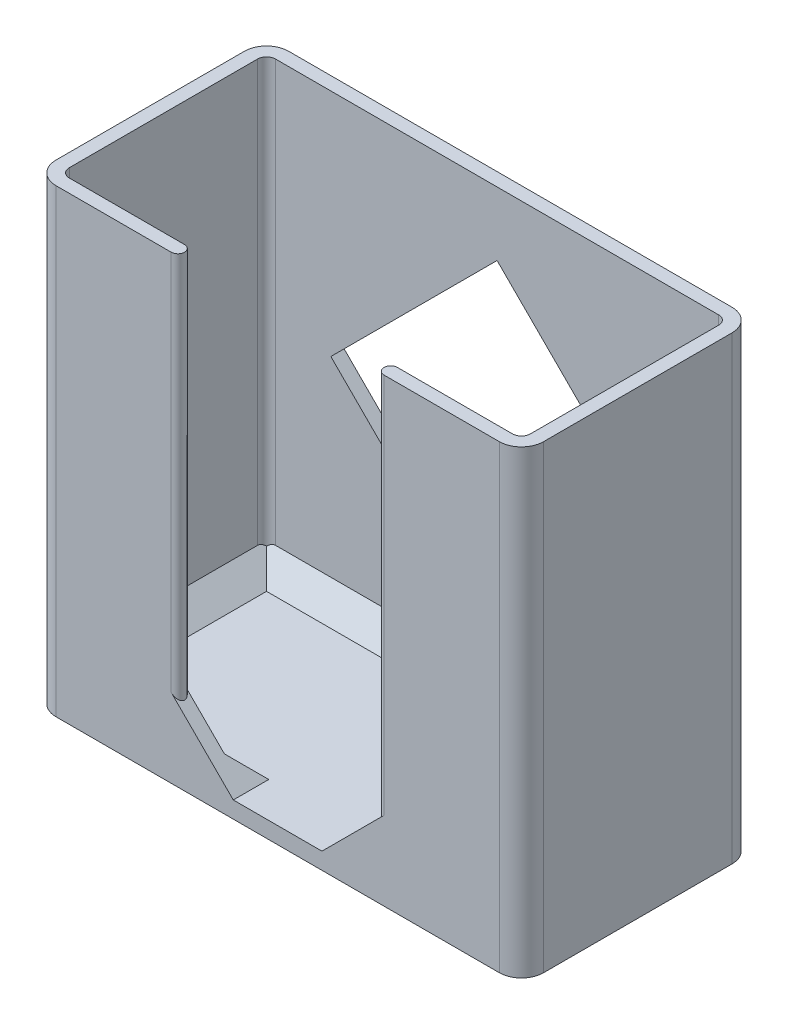
from build123d import *

# Parameters (mm, degrees)
RESSALTO_EXTRUS_O1_DEPTH = 1.5
RESSALTO_EXTRUS_O2_DEPTH = 40
ESBO_O4_W                = 18
ESBO_O4_H                = 3
CORTE_EXTRUS_O1_DEPTH    = 40
CORTE_EXTRUS_O2_DEPTH    = 8
CHANFRO1_SIZE            = 5
CHANFRO2_SIZE            = 2
FILETE2_START            = 6.5
FILETE2_DEPTH            = 35.5
FILETE2_START_2          = -3
FILETE2_2_DEPTH          = 1.232233047
FILETE3_START            = 6.5
FILETE3_DEPTH            = 35.5
FILETE3_START_2          = 1.767766953
FILETE3_2_DEPTH          = 1.232233047


with BuildPart() as part:
    # Esboço1 → Ressalto-extrusão1 (new body)
    with BuildSketch(Plane(origin=(0, 0, 0), x_dir=(1, 0, 0), z_dir=(0, 1, 0))):
        with BuildLine():
            Line((-20, -10.5), (20, -10.5))
            ThreePointArc((20, -10.5), (21.414213562, -9.914213562), (22, -8.5))
            Line((22, -8.5), (22, 8.5))
            ThreePointArc((22, 8.5), (21.414213562, 9.914213562), (20, 10.5))
            Line((20, 10.5), (-20, 10.5))
            ThreePointArc((-20, 10.5), (-21.414213562, 9.914213562), (-22, 8.5))
            Line((-22, 8.5), (-22, -8.5))
            ThreePointArc((-22, -8.5), (-21.414213562, -9.914213562), (-20, -10.5))
        make_face()
    extrude(amount=RESSALTO_EXTRUS_O1_DEPTH)

    # Esboço3 → Ressalto-extrusão2 (add)
    with BuildSketch(Plane(origin=(0, 1.5, 0), x_dir=(1, 0, 0), z_dir=(0, 1, 0))):
        with BuildLine():
            Line((-20, -10.5), (20, -10.5))
            ThreePointArc((20, -10.5), (21.414213562, -9.914213562), (22, -8.5))
            Line((22, -8.5), (22, 8.5))
            ThreePointArc((22, 8.5), (21.414213562, 9.914213562), (20, 10.5))
            Line((20, 10.5), (-20, 10.5))
            ThreePointArc((-20, 10.5), (-21.414213562, 9.914213562), (-22, 8.5))
            Line((-22, 8.5), (-22, -8.5))
            ThreePointArc((-22, -8.5), (-21.414213562, -9.914213562), (-20, -10.5))
        make_face()
        with BuildLine():
            Line((-20, 9.3), (20, 9.3))
            ThreePointArc((20, 9.3), (20.565685425, 9.065685425), (20.8, 8.5))
            Line((20.8, 8.5), (20.8, -8.5))
            ThreePointArc((20.8, -8.5), (20.565685425, -9.065685425), (20, -9.3))
            Line((20, -9.3), (-20, -9.3))
            ThreePointArc((-20, -9.3), (-20.565685425, -9.065685425), (-20.8, -8.5))
            Line((-20.8, -8.5), (-20.8, 8.5))
            ThreePointArc((-20.8, 8.5), (-20.565685425, 9.065685425), (-20, 9.3))
        make_face(mode=Mode.SUBTRACT)
    extrude(amount=RESSALTO_EXTRUS_O2_DEPTH)

    # Esboço4 → Corte-extrusão1 (cut)
    with BuildSketch(Plane(origin=(0, 41.5, 0), x_dir=(1, 0, 0), z_dir=(0, 1, 0))):
        with Locations((0, -9.3)):
            Rectangle(ESBO_O4_W, ESBO_O4_H)
    extrude(amount=-CORTE_EXTRUS_O1_DEPTH, mode=Mode.SUBTRACT)

    # Esboço5 → Corte-extrusão2 (cut)
    with BuildSketch(Plane(origin=(0, 0, -10.5), x_dir=(-1, 0, 0), z_dir=(0, 0, -1))):
        Polygon((0, 5.75), (15, 20.75), (0, 35.75), (-15, 20.75), align=None)
    extrude(amount=-CORTE_EXTRUS_O2_DEPTH, mode=Mode.SUBTRACT)

    # Chanfro1
    chanfro1_edges = [part.edges().sort_by_distance(p)[0] for p in [
        (9, 1.5, 9.9),
        (-9, 1.5, 9.9),
    ]]
    chamfer(chanfro1_edges, length=CHANFRO1_SIZE)

    # Chanfro2
    # the kernel refuses this chamfer: 2 mm, written as the material it adds along each edge
    with BuildSketch(Plane(origin=(-1.143365976, 1.5, 9.3), x_dir=(0, 1, 0), z_dir=(1, 0, 0))) as chanfro2_piece_1_section:
        Polygon((CHANFRO2_SIZE, 0), (0, -CHANFRO2_SIZE), (0, 0), align=None)
    chanfro2_piece_1 = extrude(amount=26.286731952, mode=Mode.PRIVATE)
    chanfro2_piece_1 = split(chanfro2_piece_1, bisect_by=Plane(origin=(20.8, 1.5, 9.3), z_dir=(-1, 0, 0)), keep=Keep.TOP, mode=Mode.PRIVATE)
    chanfro2_piece_1 = split(chanfro2_piece_1, bisect_by=Plane(origin=(1.428317012, -1.071682988, 9.3), z_dir=(0.7071067811865476, -0.7071067811865476, 0)), keep=Keep.TOP, mode=Mode.PRIVATE)
    add(chanfro2_piece_1)
    with BuildSketch(Plane(origin=(20.8, 1.5, -13.643365976), x_dir=(0, 1, 0), z_dir=(0, 0, 1))) as chanfro2_piece_2_section:
        Polygon((CHANFRO2_SIZE, 0), (0, CHANFRO2_SIZE), (0, 0), align=None)
    chanfro2_piece_2 = extrude(amount=27.286731952, mode=Mode.PRIVATE)
    chanfro2_piece_2 = split(chanfro2_piece_2, bisect_by=Plane(origin=(20.8, 1.5, -9.3), z_dir=(0, 0, 1)), keep=Keep.TOP, mode=Mode.PRIVATE)
    chanfro2_piece_2 = split(chanfro2_piece_2, bisect_by=Plane(origin=(20.8, 1.5, 9.3), z_dir=(0, 0, -1)), keep=Keep.TOP, mode=Mode.PRIVATE)
    add(chanfro2_piece_2)
    with BuildSketch(Plane(origin=(-25.143365976, 1.5, 9.3), x_dir=(0, 1, 0), z_dir=(1, 0, 0))) as chanfro2_piece_3_section:
        Polygon((CHANFRO2_SIZE, 0), (0, -CHANFRO2_SIZE), (0, 0), align=None)
    chanfro2_piece_3 = extrude(amount=26.286731952, mode=Mode.PRIVATE)
    chanfro2_piece_3 = split(chanfro2_piece_3, bisect_by=Plane(origin=(-20.8, 1.5, 9.3), z_dir=(1, 0, 0)), keep=Keep.TOP, mode=Mode.PRIVATE)
    chanfro2_piece_3 = split(chanfro2_piece_3, bisect_by=Plane(origin=(-14.571682988, 12.071682988, 9.3), z_dir=(-0.7071067811865476, -0.7071067811865476, 0)), keep=Keep.TOP, mode=Mode.PRIVATE)
    add(chanfro2_piece_3)
    with BuildSketch(Plane(origin=(-20.8, 1.5, 13.643365976), x_dir=(0, 1, 0), z_dir=(0, 0, -1))) as chanfro2_piece_4_section:
        Polygon((CHANFRO2_SIZE, 0), (0, CHANFRO2_SIZE), (0, 0), align=None)
    chanfro2_piece_4 = extrude(amount=27.286731952, mode=Mode.PRIVATE)
    chanfro2_piece_4 = split(chanfro2_piece_4, bisect_by=Plane(origin=(-20.8, 1.5, -9.3), z_dir=(0, 0, 1)), keep=Keep.TOP, mode=Mode.PRIVATE)
    chanfro2_piece_4 = split(chanfro2_piece_4, bisect_by=Plane(origin=(-20.8, 1.5, 9.3), z_dir=(0, 0, -1)), keep=Keep.TOP, mode=Mode.PRIVATE)
    add(chanfro2_piece_4)
    with BuildSketch(Plane(origin=(-25.143365976, 1.5, -9.3), x_dir=(0, 1, 0), z_dir=(1, 0, 0))) as chanfro2_piece_5_section:
        Polygon((CHANFRO2_SIZE, 0), (0, CHANFRO2_SIZE), (0, 0), align=None)
    chanfro2_piece_5 = extrude(amount=50.286731952, mode=Mode.PRIVATE)
    chanfro2_piece_5 = split(chanfro2_piece_5, bisect_by=Plane(origin=(20.8, 1.5, -9.3), z_dir=(-1, 0, 0)), keep=Keep.TOP, mode=Mode.PRIVATE)
    chanfro2_piece_5 = split(chanfro2_piece_5, bisect_by=Plane(origin=(-20.8, 1.5, -9.3), z_dir=(1, 0, 0)), keep=Keep.TOP, mode=Mode.PRIVATE)
    add(chanfro2_piece_5)
    with BuildSketch(Plane(origin=(-20, 1.5, -8.5), x_dir=(-1, 0, 0), z_dir=(0, 0, 1))) as chanfro2_piece_6_section:
        Polygon((0.8, -CHANFRO2_SIZE), (0, -1.2), (0, 0), (0.8, 0), align=None)
    chanfro2_piece_6 = revolve(axis=Axis((-20, 1.5, -8.5), (0, -1, 0)), revolution_arc=90, mode=Mode.PRIVATE)
    chanfro2_piece_6 = split(chanfro2_piece_6, bisect_by=Plane(origin=(-19.4, 2.1, -8.5), z_dir=(-0.7071067811865476, -0.7071067811865476, 0)), keep=Keep.TOP, mode=Mode.PRIVATE)
    add(chanfro2_piece_6)
    with BuildSketch(Plane(origin=(-20, 1.5, -8.5), x_dir=(-1, 0, 0), z_dir=(0, 0, 1))) as chanfro2_piece_7_section:
        Polygon((0.8, -CHANFRO2_SIZE), (0, -1.2), (0, 0), (0.8, 0), align=None)
    chanfro2_piece_7 = revolve(axis=Axis((-20, 1.5, -8.5), (0, -1, 0)), revolution_arc=90, mode=Mode.PRIVATE)
    chanfro2_piece_7 = split(chanfro2_piece_7, bisect_by=Plane(origin=(-20, 2.1, -7.9), z_dir=(0, -0.7071067811865476, -0.7071067811865476)), keep=Keep.TOP, mode=Mode.PRIVATE)
    add(chanfro2_piece_7)
    with BuildSketch(Plane(origin=(20, 1.5, -8.5), x_dir=(0, 0, -1), z_dir=(-1, 0, 0))) as chanfro2_piece_8_section:
        Polygon((0.8, -CHANFRO2_SIZE), (0, -1.2), (0, 0), (0.8, 0), align=None)
    chanfro2_piece_8 = revolve(axis=Axis((20, 1.5, -8.5), (0, -1, 0)), revolution_arc=90, mode=Mode.PRIVATE)
    chanfro2_piece_8 = split(chanfro2_piece_8, bisect_by=Plane(origin=(20, 2.1, -7.9), z_dir=(0, -0.7071067811865476, -0.7071067811865476)), keep=Keep.TOP, mode=Mode.PRIVATE)
    add(chanfro2_piece_8)
    with BuildSketch(Plane(origin=(20, 1.5, -8.5), x_dir=(0, 0, -1), z_dir=(-1, 0, 0))) as chanfro2_piece_9_section:
        Polygon((0.8, -CHANFRO2_SIZE), (0, -1.2), (0, 0), (0.8, 0), align=None)
    chanfro2_piece_9 = revolve(axis=Axis((20, 1.5, -8.5), (0, -1, 0)), revolution_arc=90, mode=Mode.PRIVATE)
    chanfro2_piece_9 = split(chanfro2_piece_9, bisect_by=Plane(origin=(19.4, 2.1, -8.5), z_dir=(0.7071067811865476, -0.7071067811865476, 0)), keep=Keep.TOP, mode=Mode.PRIVATE)
    add(chanfro2_piece_9)
    with BuildSketch(Plane(origin=(-20, 1.5, 8.5), x_dir=(0, 0, 1), z_dir=(1, 0, 0))) as chanfro2_piece_10_section:
        Polygon((0.8, -CHANFRO2_SIZE), (0, -1.2), (0, 0), (0.8, 0), align=None)
    chanfro2_piece_10 = revolve(axis=Axis((-20, 1.5, 8.5), (0, -1, 0)), revolution_arc=90, mode=Mode.PRIVATE)
    chanfro2_piece_10 = split(chanfro2_piece_10, bisect_by=Plane(origin=(-20, 2.1, 7.9), z_dir=(0, -0.7071067811865476, 0.7071067811865476)), keep=Keep.TOP, mode=Mode.PRIVATE)
    add(chanfro2_piece_10)
    with BuildSketch(Plane(origin=(-20, 1.5, 8.5), x_dir=(0, 0, 1), z_dir=(1, 0, 0))) as chanfro2_piece_11_section:
        Polygon((0.8, -CHANFRO2_SIZE), (0, -1.2), (0, 0), (0.8, 0), align=None)
    chanfro2_piece_11 = revolve(axis=Axis((-20, 1.5, 8.5), (0, -1, 0)), revolution_arc=90, mode=Mode.PRIVATE)
    chanfro2_piece_11 = split(chanfro2_piece_11, bisect_by=Plane(origin=(-19.4, 2.1, 8.5), z_dir=(-0.7071067811865476, -0.7071067811865476, 0)), keep=Keep.TOP, mode=Mode.PRIVATE)
    add(chanfro2_piece_11)
    with BuildSketch(Plane(origin=(20, 1.5, 8.5), x_dir=(1, 0, 0), z_dir=(0, 0, -1))) as chanfro2_piece_12_section:
        Polygon((0.8, -CHANFRO2_SIZE), (0, -1.2), (0, 0), (0.8, 0), align=None)
    chanfro2_piece_12 = revolve(axis=Axis((20, 1.5, 8.5), (0, -1, 0)), revolution_arc=90, mode=Mode.PRIVATE)
    chanfro2_piece_12 = split(chanfro2_piece_12, bisect_by=Plane(origin=(19.4, 2.1, 8.5), z_dir=(0.7071067811865476, -0.7071067811865476, 0)), keep=Keep.TOP, mode=Mode.PRIVATE)
    add(chanfro2_piece_12)
    with BuildSketch(Plane(origin=(20, 1.5, 8.5), x_dir=(1, 0, 0), z_dir=(0, 0, -1))) as chanfro2_piece_13_section:
        Polygon((0.8, -CHANFRO2_SIZE), (0, -1.2), (0, 0), (0.8, 0), align=None)
    chanfro2_piece_13 = revolve(axis=Axis((20, 1.5, 8.5), (0, -1, 0)), revolution_arc=90, mode=Mode.PRIVATE)
    chanfro2_piece_13 = split(chanfro2_piece_13, bisect_by=Plane(origin=(20, 2.1, 7.9), z_dir=(0, -0.7071067811865476, 0.7071067811865476)), keep=Keep.TOP, mode=Mode.PRIVATE)
    add(chanfro2_piece_13)

    # Filete2: read off the stored shape, not the designer's step
    # Filete2 outline → Filete2 (cut)
    with BuildSketch(Plane(origin=(0, 0, 0), x_dir=(1, 0, 0), z_dir=(0, 1, 0)).offset(FILETE2_START)):
        with BuildLine():
            ThreePointArc((-9.6, -9.3), (-9.175735931, -9.475735931), (-9, -9.9))
            Line((-9, -9.9), (-9, -9.3))
            Line((-9, -9.3), (-9.6, -9.3))
        make_face()
        with BuildLine():
            ThreePointArc((-9, -9.9), (-9.175735931, -10.324264069), (-9.6, -10.5))
            Line((-9.6, -10.5), (-9, -10.5))
            Line((-9, -10.5), (-9, -9.9))
        make_face()
    extrude(amount=FILETE2_DEPTH, mode=Mode.SUBTRACT)

    # Filete2 2 outline → Filete2 2 (add)
    with BuildSketch(Plane(origin=(0, 0, 0), x_dir=(0.7071067811865509, -0.707106781186544, 0), z_dir=(0.707106781186544, 0.707106781186551, 0)).offset(FILETE2_START_2)):
        with BuildLine():
            Line((-3.889087297, -7.3), (-6.717514421, -9.3))
            Line((-6.717514421, -9.3), (-11.808683246, -9.3))
            add(Edge.make_bspline(
                [(-11.808683246, -10.5), (-10.960155108, -10.5), (-10.960155108, -9.9), (-10.960155108, -9.3), (-11.808683246, -9.3)],
                knots=[1.570796327, 1.570796327, 1.570796327, 3.141592654, 3.141592654, 4.71238898, 4.71238898, 4.71238898], degree=2, weights=[1, 0.707106781, 1, 0.707106781, 1]))
            Line((-11.808683246, -10.5), (-3.889087297, -10.5))
            Line((-3.889087297, -10.5), (-3.889087297, -7.3))
        make_face()
    extrude(amount=FILETE2_2_DEPTH)

    # Filete3: read off the stored shape, not the designer's step
    # Filete3 outline → Filete3 (cut)
    with BuildSketch(Plane(origin=(0, 0, 0), x_dir=(1, 0, 0), z_dir=(0, 1, 0)).offset(FILETE3_START)):
        with BuildLine():
            Line((9, -10.5), (9.6, -10.5))
            ThreePointArc((9.6, -10.5), (9.175735931, -10.324264069), (9, -9.9))
            Line((9, -9.9), (9, -10.5))
        make_face()
        with BuildLine():
            Line((9, -9.3), (9, -9.9))
            ThreePointArc((9, -9.9), (9.175735931, -9.475735931), (9.6, -9.3))
            Line((9.6, -9.3), (9, -9.3))
        make_face()
    extrude(amount=FILETE3_DEPTH, mode=Mode.SUBTRACT)

    # Filete3 2 outline → Filete3 2 (add)
    with BuildSketch(Plane(origin=(0, 0, 0), x_dir=(0.7071067811865509, 0.707106781186544, 0), z_dir=(0.707106781186544, -0.707106781186551, 0)).offset(FILETE3_START_2)):
        with BuildLine():
            Line((11.808683246, 10.5), (3.889087297, 10.5))
            Line((3.889087297, 10.5), (3.889087297, 7.3))
            Line((3.889087297, 7.3), (6.717514421, 9.3))
            Line((6.717514421, 9.3), (11.808683246, 9.3))
            add(Edge.make_bspline(
                [(11.808683246, 9.3), (10.960155108, 9.3), (10.960155108, 9.9), (10.960155108, 10.5), (11.808683246, 10.5)],
                knots=[4.71238898, 4.71238898, 4.71238898, 6.283185307, 6.283185307, 7.853981634, 7.853981634, 7.853981634], degree=2, weights=[1, 0.707106781, 1, 0.707106781, 1]))
        make_face()
    extrude(amount=FILETE3_2_DEPTH)


solid = part.part
